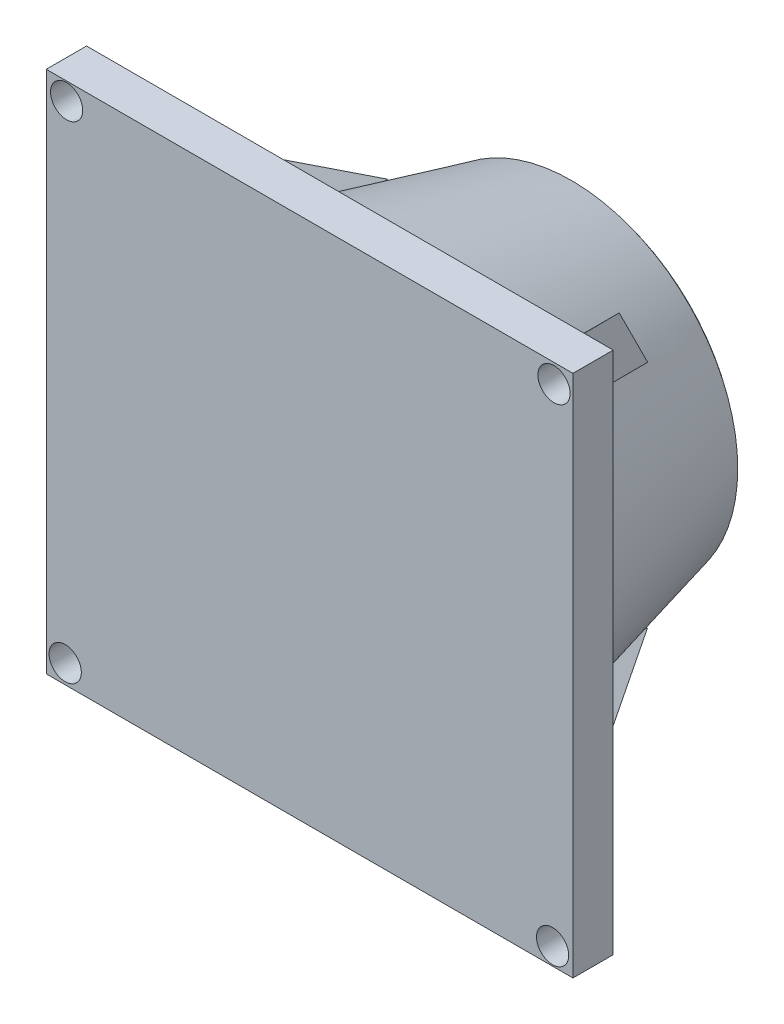
from build123d import *

# Parameters (mm, degrees)
SCHIZZO1_R                      = 400
ESTRUSIONE_ESTRUSIONE2_DEPTH    = 10
SCHIZZO2_R                      = 550
ESTRUSIONE_ESTRUSIONE3_DEPTH    = 550
ESTRUSIONE_ESTRUSIONE3_DRAFT    = -14
SCHIZZO7_W                      = 1307.512156596
SCHIZZO7_H                      = 1300
SCHIZZO7_R                      = 550
ESTRUSIONE_ESTRUSIONE4_DEPTH    = 100
ESTRUSIONE_ESTRUSIONE15_DEPTH   = 50
SCHIZZO16_R                     = 40
TAGLIO_ESTRUSIONE1_DEPTH        = 183
ESTRUSIONE_ESTRUSIONE21_DEPTH   = 50
ESTRUSIONE_ESTRUSIONE23_DEPTH   = 50
ESTRUSIONE_ESTRUSIONE23_2_DEPTH = 50
RIPETIZIONECIRCOLARE3_COUNT     = 4
SCHIZZO19_R                     = 550
ESTRUSIONE_ESTRUSIONE24_DEPTH   = 100
RACCORDO1_R                     = 13


with BuildPart() as part:
    # Schizzo1 → Estrusione-Estrusione2 (new body)
    with BuildSketch(Plane.XY.offset(10)):
        Circle(SCHIZZO1_R)
        with BuildLine():
            ThreePointArc((159.461880199, 183.128480143), (168.874067872, 192.540667817), (159.461880199, 201.952855491))
            ThreePointArc((159.461880199, 201.952855491), (150.049692525, 192.540667817), (159.461880199, 183.128480143))
        make_face(mode=Mode.SUBTRACT)
        with BuildLine():
            ThreePointArc((142.354854673, 173.854716695), (132.942666999, 164.442529021), (142.354854673, 155.030341347))
            ThreePointArc((142.354854673, 155.030341347), (151.767042347, 164.442529021), (142.354854673, 173.854716695))
        make_face(mode=Mode.SUBTRACT)
        with BuildLine():
            ThreePointArc((142.354854673, -155.030341347), (132.942666999, -164.442529021), (142.354854673, -173.854716695))
            ThreePointArc((142.354854673, -173.854716695), (151.767042347, -164.442529021), (142.354854673, -155.030341347))
        make_face(mode=Mode.SUBTRACT)
        with BuildLine():
            ThreePointArc((159.461880199, -183.128480143), (150.049692525, -192.540667817), (159.461880199, -201.952855491))
            ThreePointArc((159.461880199, -201.952855491), (168.874067872, -192.540667817), (159.461880199, -183.128480143))
        make_face(mode=Mode.SUBTRACT)
        with BuildLine():
            ThreePointArc((-217.5, 9.412187674), (-226.912187674, 0), (-217.5, -9.412187674))
            ThreePointArc((-217.5, -9.412187674), (-208.087812326, 0), (-217.5, 9.412187674))
        make_face(mode=Mode.SUBTRACT)
        with BuildLine():
            ThreePointArc((-250, 9.412187674), (-259.412187674, 0), (-250, -9.412187674))
            ThreePointArc((-250, -9.412187674), (-240.587812326, 0), (-250, 9.412187674))
        make_face(mode=Mode.SUBTRACT)
    extrude(amount=-ESTRUSIONE_ESTRUSIONE2_DEPTH)


with BuildPart() as estrusione_estrusione3_tool:
    # Schizzo2 → Estrusione-Estrusione3 (with draft: the straight prism first)
    with BuildSketch(Plane.XY.offset(560)):
        Circle(SCHIZZO2_R)
    extrude(amount=-ESTRUSIONE_ESTRUSIONE3_DEPTH)
    # Estrusione-Estrusione3: the draft: its side faces are tilted about the plane it starts from
    estrusione_estrusione3_sides = [estrusione_estrusione3_tool.faces().sort_by_distance(p)[0] for p in [
        (-550, 0, 285),
    ]]
    draft(estrusione_estrusione3_sides, Plane.XY.offset(560), ESTRUSIONE_ESTRUSIONE3_DRAFT)


with BuildPart() as part_1:
    add(part.part)

    # Estrusione-Estrusione3: add estrusione_estrusione3_tool
    add(estrusione_estrusione3_tool.part)



with BuildPart() as body_2:
    # Schizzo7 → Estrusione-Estrusione4 (new body)
    with BuildSketch(Plane.XY.offset(560)):
        Rectangle(SCHIZZO7_W, SCHIZZO7_H)
        Circle(SCHIZZO7_R, mode=Mode.SUBTRACT)
    extrude(amount=ESTRUSIONE_ESTRUSIONE4_DEPTH)

    # Schizzo16 → Taglio-Estrusione1 (cut)
    with BuildSketch(Plane(origin=(0, 0, 560), x_dir=(-1, 0, 0), z_dir=(0, 0, -1))):
        with Locations((-606.722155674, 603.236305221)):
            Circle(SCHIZZO16_R)
    taglio_estrusione1 = extrude(amount=-TAGLIO_ESTRUSIONE1_DEPTH, mode=Mode.SUBTRACT)

    # RipetizioneCircolare3: Taglio-Estrusione1 ×4 about axis
    ripetizionecircolare3_axis = Axis((0, 0, 0), (0, 0, 1))
    for i in range(1, RIPETIZIONECIRCOLARE3_COUNT):
        add(taglio_estrusione1.rotate(ripetizionecircolare3_axis, i * 360 / RIPETIZIONECIRCOLARE3_COUNT), mode=Mode.SUBTRACT)


with BuildPart() as body_3:
    # Schizzo15 → Estrusione-Estrusione15 (new, symmetric)
    with BuildSketch(Plane(origin=(0, 0, 0), x_dir=(-0.7091409896026719, -0.7050667038410928, 0), z_dir=(0.7050667038410928, -0.7091409896026719, 0))):
        Polygon((-721.89858982, -560), (-454.943274801, -178.748298966), (-454.943274801, -560), align=None)
    extrude(amount=ESTRUSIONE_ESTRUSIONE15_DEPTH, both=True)


with BuildPart() as body_4:
    # Schizzo17 → Estrusione-Estrusione21 (new, symmetric)
    with BuildSketch(Plane(origin=(0, 0, 0), x_dir=(-0.7091409896026719, -0.7050667038410928, 0), z_dir=(0.7050667038410928, -0.7091409896026719, 0))):
        Polygon((721.89858982, -560), (454.943274801, -178.748298966), (454.943274801, -560), align=None)
    extrude(amount=ESTRUSIONE_ESTRUSIONE21_DEPTH, both=True)


with BuildPart() as body_5:
    # Schizzo18 → Estrusione-Estrusione23 (new, symmetric)
    with BuildSketch(Plane(origin=(0, 0, 0), x_dir=(0.7091409896026718, -0.7050667038410929, 0), z_dir=(0.7050667038410929, 0.7091409896026718, 0))):
        Polygon((-721.89858982, -560), (-454.943274801, -178.748298966), (-454.943274801, -560), align=None)
    extrude(amount=ESTRUSIONE_ESTRUSIONE23_DEPTH, both=True)


with BuildPart() as body_6:
    # Schizzo18 → Estrusione-Estrusione23 2 (new, symmetric)
    with BuildSketch(Plane(origin=(0, 0, 0), x_dir=(0.7091409896026718, -0.7050667038410929, 0), z_dir=(0.7050667038410929, 0.7091409896026718, 0))):
        Polygon((721.89858982, -560), (454.943274801, -178.748298966), (454.943274801, -560), align=None)
    extrude(amount=ESTRUSIONE_ESTRUSIONE23_2_DEPTH, both=True)


with BuildPart() as part_2:
    add(part_1.part)

    add(body_2.part)  # Estrusione-Estrusione24 merges body 2

    add(body_3.part)  # Estrusione-Estrusione24 merges body 3

    add(body_4.part)  # Estrusione-Estrusione24 merges body 4

    add(body_5.part)  # Estrusione-Estrusione24 merges body 5

    add(body_6.part)  # Estrusione-Estrusione24 merges body 6
    # Schizzo19 → Estrusione-Estrusione24 (add)
    with BuildSketch(Plane.XY.offset(560)):
        Circle(SCHIZZO19_R)
    extrude(amount=ESTRUSIONE_ESTRUSIONE24_DEPTH)

    # Raccordo1
    # the kernel refuses this fillet: 13 mm, written as the material it adds along each edge
    with BuildSketch(Plane(origin=(0, 0, 10), x_dir=(1, 0, 0), z_dir=(0, -1, 0))) as raccordo1_piece_1:
        with BuildLine():
            CenterArc((412.649110641, -13), RACCORDO1_R, 90, 76.657636203)
            Line((400, -10), (400, 0))
            Line((400, 0), (412.649110641, 0))
        make_face()
    revolve(axis=Axis((0, 0, 10), (0, 0, 1)))


solid = part_2.part
